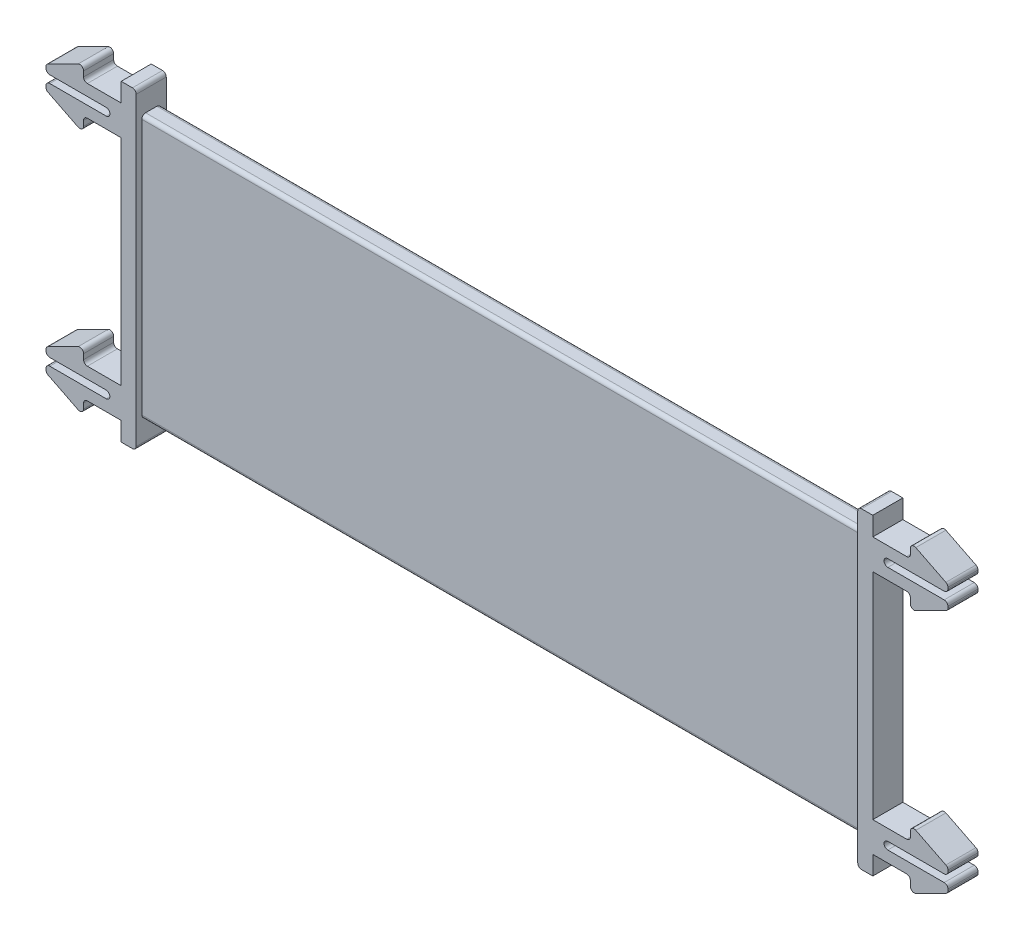
from build123d import *

# Parameters (mm, degrees)
BOSS_EXTRUDE1_DEPTH    = 8
FILLET2_R              = 1
FILLET3_R              = 1
SPLIT1_SURFACE_1_BACK  = 122.606
SPLIT1_SURFACE_1_DEPTH = 245.212
SPLIT1_SURFACE_2_BACK  = 122.606
SPLIT1_SURFACE_2_DEPTH = 245.212
LPATTERN1_START        = -8
LPATTERN1_DEPTH        = 8
SKETCH5_W              = 96
SKETCH5_H              = 8
BOSS_EXTRUDE4_DEPTH    = 73.142857143
MOVE_START             = 123.737340417
MOVE_FACE1_OUTLINE_W   = 96
MOVE_FACE1_OUTLINE_H   = 1.5
MOVE_FACE1_DEPTH       = 73.142857142
MOVE_FACE1_2_OUTLINE_W = 96
MOVE_FACE1_2_OUTLINE_H = 5
MOVE_FACE1_2_DEPTH     = 1.5
MOVE_START_2           = 195.380197559
MOVE_FACE1_3_OUTLINE_W = 96
MOVE_FACE1_3_OUTLINE_H = 5
MOVE_FACE1_3_DEPTH     = 1.5
SKETCH6_W              = 4
SKETCH6_H              = 8
BOSS_EXTRUDE3_DEPTH    = 83.142857143
FILLET4_R              = 1
FILLET5_R              = 1


# Read off the part's stored shape, not the designer's step: LPattern1, Move Face1
with BuildPart() as part:
    # Sketch1 (on Front Plane) → Boss-Extrude1 (new body)
    with BuildSketch(Plane.XY):
        Polygon((13.756813274, 188.880197559), (109.756813274, 188.880197559), (109.756813274, 196.880197559), (13.756813274, 196.880197559), (13.756813274, 201.880197559), (9.756813274, 201.880197559), (9.756813274, 196.880197559), (-0.243186726, 196.880197559), (-0.243186726, 200.880197559), (-10.243186726, 195.880197559), (-10.243186726, 193.880197559), (6.756813274, 193.880197559), (6.756813274, 191.880197559), (-10.243186726, 191.880197559), (-10.243186726, 189.880197559), (-0.243186726, 184.880197559), (-0.243186726, 188.880197559), (9.756813274, 188.880197559), (9.756813274, 183.880197559), (13.756813274, 183.880197559), align=None)
    extrude(amount=-BOSS_EXTRUDE1_DEPTH)

    # Fillet2
    fillet2_edges = [part.edges().sort_by_distance(p)[0] for p in [
        (6.756813274, 191.880197559, -4),
        (6.756813274, 193.880197559, -4),
    ]]
    fillet(fillet2_edges, radius=FILLET2_R - 0.0001)  # a hair under: the kernel refuses the full size

    # Fillet3
    fillet3_edges = [part.edges().sort_by_distance(p)[0] for p in [
        (-0.243186726, 196.880197559, -4),
        (-0.243186726, 200.880197559, -4),
        (-10.243186726, 195.880197559, -4),
        (-10.243186726, 193.880197559, -4),
        (-10.243186726, 191.880197559, -4),
        (-10.243186726, 189.880197559, -4),
        (-0.243186726, 184.880197559, -4),
        (-0.243186726, 188.880197559, -4),
    ]]
    fillet(fillet3_edges, radius=FILLET3_R)


with BuildPart() as body_2:
    # Split1: the piece behind the surface
    add(part.part)
    # Split1 surface: a surface, the sketch's curves swept straight by 245.212 mm
    with BuildLine(Plane.XY.offset(-SPLIT1_SURFACE_1_BACK), mode=Mode.PRIVATE) as split1_surface_1_path:
        Line((13.756813274, 196.880197559), (13.756813274, 188.880197559))
    split1_surface_1 = Shell.extrude(split1_surface_1_path.wire(), (0 * SPLIT1_SURFACE_1_DEPTH, 0 * SPLIT1_SURFACE_1_DEPTH, 1 * SPLIT1_SURFACE_1_DEPTH))
    split(bisect_by=split1_surface_1, keep=Keep.BOTTOM)



with BuildPart() as part_1:
    add(part.part)

    # Split1: split by a surface, the side it looks to stays
    # Split1 surface: a surface, the sketch's curves swept straight by 245.212 mm
    with BuildLine(Plane.XY.offset(-SPLIT1_SURFACE_2_BACK), mode=Mode.PRIVATE) as split1_surface_2_path:
        Line((13.756813274, 196.880197559), (13.756813274, 188.880197559))
    split1_surface_2 = Shell.extrude(split1_surface_2_path.wire(), (0 * SPLIT1_SURFACE_2_DEPTH, 0 * SPLIT1_SURFACE_2_DEPTH, 1 * SPLIT1_SURFACE_2_DEPTH))
    split(bisect_by=split1_surface_2, keep=Keep.TOP)


with BuildPart() as body_3:
    # LPattern1 outline → LPattern1 (new body)
    with BuildSketch(Plane.XY.offset(LPATTERN1_START)):
        with BuildLine():
            Line((0.756813274, 123.737340417), (9.756813274, 123.737340417))
            Line((9.756813274, 123.737340417), (9.756813274, 118.737340417))
            Line((9.756813274, 118.737340417), (13.756813274, 118.737340417))
            Line((13.756813274, 118.737340417), (13.756813274, 136.737340417))
            Line((13.756813274, 136.737340417), (9.756813274, 136.737340417))
            Line((9.756813274, 136.737340417), (9.756813274, 131.737340417))
            Line((9.756813274, 131.737340417), (0.756813274, 131.737340417))
            ThreePointArc((0.756813274, 131.737340417), (0.049706492, 132.030233635), (-0.243186726, 132.737340417))
            Line((-0.243186726, 132.737340417), (-0.243186726, 134.119306428))
            ThreePointArc((-0.243186726, 134.119306428), (-0.717455614, 134.969957236), (-1.690400321, 135.013733619))
            Line((-1.690400321, 135.013733619), (-9.690400321, 131.013733619))
            ThreePointArc((-9.690400321, 131.013733619), (-10.093837534, 130.64503754), (-10.243186726, 130.119306428))
            Line((-10.243186726, 130.119306428), (-10.243186726, 129.737340417))
            ThreePointArc((-10.243186726, 129.737340417), (-9.950293508, 129.030233635), (-9.243186726, 128.737340417))
            Line((-9.243186726, 128.737340417), (5.756813274, 128.737340417))
            ThreePointArc((5.756813274, 128.737340417), (6.463920055, 128.444447198), (6.756813274, 127.737340417))
            ThreePointArc((6.756813274, 127.737340417), (6.463920055, 127.030233635), (5.756813274, 126.737340417))
            Line((5.756813274, 126.737340417), (-9.243186726, 126.737340417))
            ThreePointArc((-9.243186726, 126.737340417), (-9.950293507, 126.444447198), (-10.243186726, 125.737340417))
            Line((-10.243186726, 125.737340417), (-10.243186726, 125.355374405))
            ThreePointArc((-10.243186726, 125.355374405), (-10.093837534, 124.829643293), (-9.690400321, 124.460947214))
            Line((-9.690400321, 124.460947214), (-1.690400321, 120.460947214))
            ThreePointArc((-1.690400321, 120.460947214), (-0.717455614, 120.504723597), (-0.243186726, 121.355374405))
            Line((-0.243186726, 121.355374405), (-0.243186726, 122.737340417))
            ThreePointArc((-0.243186726, 122.737340417), (0.049706493, 123.444447198), (0.756813274, 123.737340417))
        make_face()
    extrude(amount=LPATTERN1_DEPTH)


with BuildPart() as body_4:
    # Sketch5 → Boss-Extrude4 (new body)
    with BuildSketch(Plane(origin=(0, 196.880197559, 0), x_dir=(1, 0, 0), z_dir=(0, 1, 0))):
        with Locations((61.756813274, 4)):
            Rectangle(SKETCH5_W, SKETCH5_H)
    extrude(amount=-BOSS_EXTRUDE4_DEPTH)

    # Move Face1 outline → Move Face1 (cut)
    with BuildSketch(Plane(origin=(0, 0, 0), x_dir=(1, 0, 0), z_dir=(0, 1, 0)).offset(MOVE_START)):
        with Locations((61.756813274, 7.25)):
            Rectangle(MOVE_FACE1_OUTLINE_W, MOVE_FACE1_OUTLINE_H)
        with Locations((61.756813274, 0.75)):
            Rectangle(MOVE_FACE1_OUTLINE_W, MOVE_FACE1_OUTLINE_H)
    extrude(amount=MOVE_FACE1_DEPTH, mode=Mode.SUBTRACT)

    # Move Face1 2 outline → Move Face1 2 (cut)
    with BuildSketch(Plane(origin=(0, 0, 0), x_dir=(1, 0, 0), z_dir=(0, 1, 0)).offset(MOVE_START)):
        with Locations((61.756813274, 4)):
            Rectangle(MOVE_FACE1_2_OUTLINE_W, MOVE_FACE1_2_OUTLINE_H)
    extrude(amount=MOVE_FACE1_2_DEPTH, mode=Mode.SUBTRACT)

    # Move Face1 3 outline → Move Face1 3 (cut)
    with BuildSketch(Plane(origin=(0, 0, 0), x_dir=(1, 0, 0), z_dir=(0, 1, 0)).offset(MOVE_START_2)):
        with Locations((61.756813274, 4)):
            Rectangle(MOVE_FACE1_3_OUTLINE_W, MOVE_FACE1_3_OUTLINE_H)
    extrude(amount=MOVE_FACE1_3_DEPTH, mode=Mode.SUBTRACT)


with BuildPart() as body_2_1:
    add(body_2.part)

    add(body_3.part)  # Boss-Extrude3 merges body 3

    add(body_4.part)  # Boss-Extrude3 merges body 4
    # Sketch6 → Boss-Extrude3 (add)
    with BuildSketch(Plane(origin=(0, 201.880197559, 0), x_dir=(1, 0, 0), z_dir=(0, 1, 0))):
        with Locations((11.756813274, 4)):
            Rectangle(SKETCH6_W, SKETCH6_H)
    extrude(amount=-BOSS_EXTRUDE3_DEPTH)

    # Fillet4
    fillet4_edges = [body_2_1.edges().sort_by_distance(p)[0] for p in [
        (13.756813274, 118.737340417, -4),
        (13.756813274, 201.880197559, -4),
    ]]
    fillet(fillet4_edges, radius=FILLET4_R)

    # Mirror1: body 2 across plane


with BuildPart() as body_2_2:
    add(body_2_1.part)
    add(body_2_1.part.mirror(Plane(origin=(109.756813274, 27.404583786, 0), x_dir=(0, 0, 1), z_dir=(1, 0, 0))))

    # Fillet5
    fillet5_edges = [body_2_2.edges().sort_by_distance(p)[0] for p in [
        (109.756813274, 195.380197559, -1.5),
        (109.756813274, 195.380197559, -6.5),
        (109.756813274, 125.237340417, -6.5),
        (109.756813274, 125.237340417, -1.5),
    ]]
    fillet(fillet5_edges, radius=FILLET5_R)


solid = body_2_2.part
